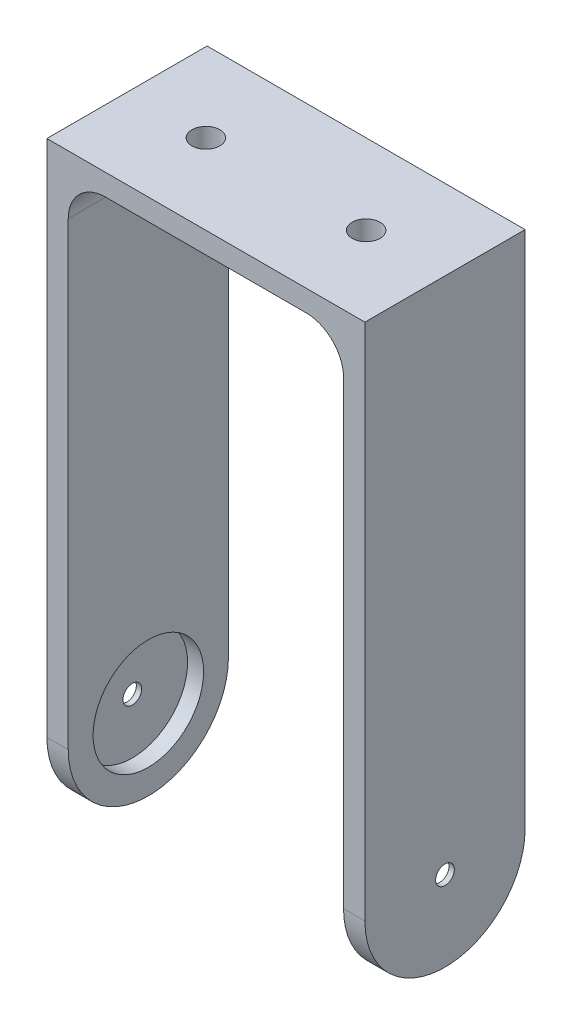
from build123d import *

# Parameters (mm, degrees)
EXTRUDE_2_DEPTH     = 15
SKETCH_2_R          = 2.62067407
CUT_EXTRUDE_1_DEPTH = 30
CUT_EXTRUDE_2_DEPTH = 3
SKETCH_5_R          = 10.35
CUT_EXTRUDE_3_DEPTH = 3
SKETCH_6_R          = 1.75
CUT_EXTRUDE_4_DEPTH = 73
FILLET_1_R          = 7
FILLET_2_R          = 15
CUT_EXTRUDE_5_DEPTH = 80


with BuildPart() as part:
    # 草图1 → 拉伸-薄壁2 (new, symmetric)
    with BuildSketch(Plane.XY):
        Polygon((29.774038515, -24.3), (29.774038515, 97.117302362), (0, 97.117302362), (-29.774038515, 97.117302362), (-29.774038515, -24.3), (-25.774038515, -24.3), (-25.774038515, 93.117302362), (0, 93.117302362), (25.774038515, 93.117302362), (25.774038515, -24.3), align=None)
    extrude(amount=EXTRUDE_2_DEPTH, both=True)

    # 草图2 → 切除-拉伸1 (cut)
    with BuildSketch(Plane(origin=(0, 97.117302362, 0), x_dir=(1, 0, 0), z_dir=(0, 1, 0))):
        with Locations(Location((-15, 0, 0), (0, 0, 270))):
            Circle(SKETCH_2_R)
        with Locations(Location((15, 0, 0), (0, 0, 270))):
            Circle(SKETCH_2_R)
    extrude(amount=-CUT_EXTRUDE_1_DEPTH, mode=Mode.SUBTRACT)

    # 草图4 → 切除-拉伸2 (cut)
    with BuildSketch(Plane.ZY.offset(-25.774038515)):
        with BuildLine():
            Line((-2.776256892, 22.163864907), (-5.090172263, 4.508896355))
            ThreePointArc((-5.090172263, 4.508896355), (-6.8, 0), (-5.090172263, -4.508896355))
            Line((-5.090172263, -4.508896355), (-2.776256892, -22.163864907))
            ThreePointArc((-2.776256892, -22.163864907), (0, -24.6), (2.776256892, -22.163864907))
            Line((2.776256892, -22.163864907), (5.090172263, -4.508896355))
            ThreePointArc((5.090172263, -4.508896355), (6.8, 0), (5.090172263, 4.508896355))
            Line((5.090172263, 4.508896355), (2.776256892, 22.163864907))
            ThreePointArc((2.776256892, 22.163864907), (0, 24.6), (-2.776256892, 22.163864907))
        make_face()
    extrude(amount=-CUT_EXTRUDE_2_DEPTH, mode=Mode.SUBTRACT)

    # 草图5 → 切除-拉伸3 (cut)
    with BuildSketch(Plane(origin=(-25.774038515, 0, 0), x_dir=(0, 0, -1), z_dir=(1, 0, 0))):
        Circle(SKETCH_5_R)
    extrude(amount=-CUT_EXTRUDE_3_DEPTH, mode=Mode.SUBTRACT)

    # 草图6 → 切除-拉伸4 (cut)
    with BuildSketch(Plane.ZY.offset(29.774038515)):
        Circle(SKETCH_6_R)
    extrude(amount=-CUT_EXTRUDE_4_DEPTH, mode=Mode.SUBTRACT)

    # 圆角1
    fillet_1_edges = [part.edges().sort_by_distance(p)[0] for p in [
        (25.774038515, 93.117302362, 0),
        (-25.774038515, 93.117302362, 0),
    ]]
    fillet(fillet_1_edges, radius=FILLET_1_R)

    # 圆角2
    fillet_2_edges = [part.edges().sort_by_distance(p)[0] for p in [
        (27.774038515, -24.3, -15),
        (-27.774038515, -24.3, -15),
        (-27.774038515, -24.3, 15),
        (27.774038515, -24.3, 15),
    ]]
    fillet(fillet_2_edges, radius=FILLET_2_R - 0.0001)  # a hair under: the kernel refuses the full size

    # 草图7 → 切除-拉伸5 (cut)
    with BuildSketch(Plane.ZY.offset(29.774038515)):
        with BuildLine():
            ThreePointArc((15, 0), (0, -15), (-15, 0))
            Line((-15, 0), (-15, -9.3))
            ThreePointArc((-15, -9.3), (-10.606601718, -19.906601718), (0, -24.3))
            ThreePointArc((0, -24.3), (10.606601718, -19.906601718), (15, -9.3))
            Line((15, -9.3), (15, 0))
        make_face()
    extrude(amount=-CUT_EXTRUDE_5_DEPTH, mode=Mode.SUBTRACT)


with BuildPart() as cut_extrude_5_kept_piece:
    # of the separate pieces the step leaves, the one the design keeps (cut_extrude_5_pieces_kept)
    add(part.part.solids().sort_by_distance((-29.774038515, 0, -15))[0])


solid = cut_extrude_5_kept_piece.part
